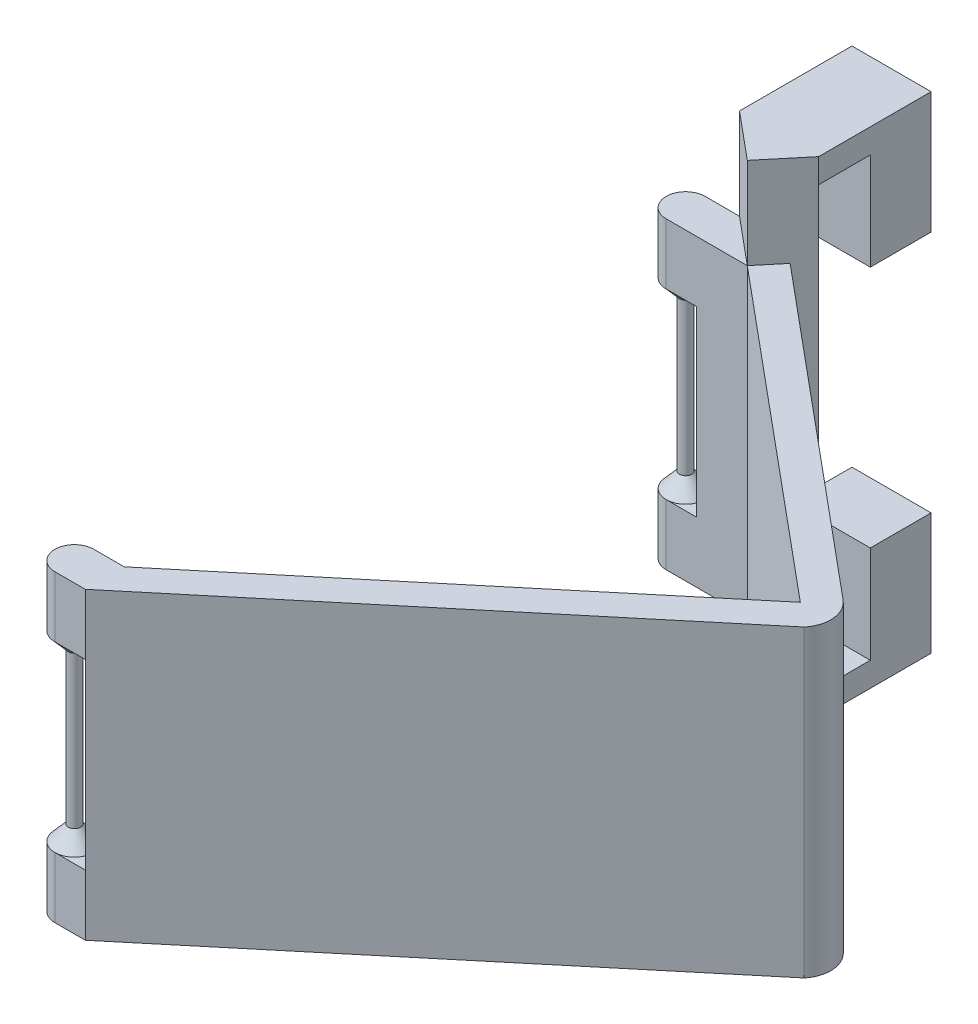
from build123d import *

# Parameters (mm, degrees)
EXTRUDE_1_DEPTH  = 50
EXTRUDE_START    = -50
EXTRUDE_3_DEPTH  = 65
SKETCH_5_W       = 13.017082793
SKETCH_5_H       = 4
EXTRUDE_4_DEPTH  = 18.5
SKETCH_6_W       = 13.017082793
SKETCH_6_H       = 10
EXTRUDE_5_DEPTH  = 16
EXTRUDE_6_DEPTH  = 50
EXTRUDE_7_DEPTH  = 10
EXTRUDE_8_DEPTH  = 10
SKETCH_11_R      = 1
EXTRUDE_9_DEPTH  = 30
SKETCH_15_R      = 1
EXTRUDE_10_DEPTH = 30


with BuildPart() as part:
    # 草图1 → 凸台-拉伸1 (new body)
    with BuildSketch(Plane(origin=(0, 0, 0), x_dir=(1, 0, 0), z_dir=(0, 1, 0))):
        with BuildLine():
            Line((7.810249676, 50), (0, 50))
            Line((0, 50), (60, 0))
            Line((60, 0), (-0.663965605, -50.553304671))
            Line((-0.663965605, -50.553304671), (-0.663965605, -56.955148667))
            Line((-0.663965605, -56.955148667), (63.841106398, -3.200921998))
            ThreePointArc((63.841106398, -3.200921998), (64.979466032, 0.45267873), (63.200921998, 3.841106398))
            Line((63.200921998, 3.841106398), (7.810249676, 50))
        make_face()
    extrude(amount=EXTRUDE_1_DEPTH)

    # 草图4 → 凸台-拉伸3 (add)
    with BuildSketch(Plane(origin=(0, 50, 0), x_dir=(1, 0, 0), z_dir=(0, 1, 0)).offset(EXTRUDE_START)):
        Polygon((0, 50), (7.682212796, 43.598156003), (13.017082793, 50), align=None)
    extrude_3 = extrude(amount=EXTRUDE_3_DEPTH)

    # 草图5 → 凸台-拉伸4 (add)
    with BuildSketch(Plane(origin=(0, 0, -50), x_dir=(-1, 0, 0), z_dir=(0, 0, -1))):
        with Locations((-6.508541397, 63)):
            Rectangle(SKETCH_5_W, SKETCH_5_H)
    extrude_4 = extrude(amount=EXTRUDE_4_DEPTH)

    # 草图6 → 凸台-拉伸5 (add)
    with BuildSketch(Plane.XZ.offset(-61)):
        with Locations((6.508541397, -63.5)):
            Rectangle(SKETCH_6_W, SKETCH_6_H)
    extrude_5 = extrude(amount=EXTRUDE_5_DEPTH)

    # 镜向4: 凸台-拉伸3, 凸台-拉伸4, 凸台-拉伸5 across plane
    add(extrude_3.mirror(Plane(origin=(0, 25, 0), x_dir=(0, 0, 1), z_dir=(0, -1, 0))))
    add(extrude_4.mirror(Plane(origin=(0, 25, 0), x_dir=(0, 0, 1), z_dir=(0, -1, 0))))
    add(extrude_5.mirror(Plane(origin=(0, 25, 0), x_dir=(0, 0, 1), z_dir=(0, -1, 0))))

    # 草图8 → 凸台-拉伸6 (add)
    with BuildSketch(Plane(origin=(0, 50, 0), x_dir=(1, 0, 0), z_dir=(0, 1, 0))):
        Polygon((7.682212796, 43.598156003), (-0.663965605, 43.598156003), (-0.663965605, 50), (0, 50), align=None)
    extrude(amount=-EXTRUDE_6_DEPTH)

    # 草图9 → 凸台-拉伸7 (add)
    with BuildSketch(Plane.XZ):
        with BuildLine():
            Line((-0.663965605, 50.553304671), (-0.663965605, 56.955148667))
            Line((-0.663965605, 56.955148667), (-5.663965605, 56.955148667))
            ThreePointArc((-5.663965605, 56.955148667), (-8.864887603, 53.754226669), (-5.663965605, 50.553304671))
            Line((-5.663965605, 50.553304671), (-0.663965605, 50.553304671))
        make_face()
    extrude_7 = extrude(amount=-EXTRUDE_7_DEPTH)

    # 草图10 → 凸台-拉伸8 (add)
    with BuildSketch(Plane.XZ):
        with BuildLine():
            Line((-0.663965605, -50), (-0.663965605, -43.598156003))
            Line((-0.663965605, -43.598156003), (-5.663965605, -43.598156003))
            ThreePointArc((-5.663965605, -43.598156003), (-8.864887603, -46.799078002), (-5.663965605, -50))
            Line((-5.663965605, -50), (-0.663965605, -50))
        make_face()
    extrude_8 = extrude(amount=-EXTRUDE_8_DEPTH)

    # 镜向5: 凸台-拉伸7, 凸台-拉伸8 across plane
    add(extrude_7.mirror(Plane(origin=(0, 25, 0), x_dir=(0, 0, 1), z_dir=(0, -1, 0))))
    add(extrude_8.mirror(Plane(origin=(0, 25, 0), x_dir=(0, 0, 1), z_dir=(0, -1, 0))))

    # 草图11 → 凸台-拉伸9 (add)
    with BuildSketch(Plane.XZ.offset(-40)):
        with Locations((-5.663965605, 53.754226669)):
            Circle(SKETCH_11_R)
    extrude(amount=EXTRUDE_9_DEPTH)

    # 草图14 → 旋转1 (revolve)
    with BuildSketch(Plane(origin=(0, 0, 53.754226669), x_dir=(-1, 0, 0), z_dir=(0, 0, -1))):
        Polygon((6.663965605, 12.5), (6.663965605, 10), (8.864887603, 10), align=None)
    revolve_1 = revolve(axis=Axis((-5.663965605, 10, 53.754226669), (0, 1, 0)))

    # 镜向6: 旋转1 across plane
    add(revolve_1.mirror(Plane(origin=(0, 25, 0), x_dir=(0, 0, 1), z_dir=(0, -1, 0))))

    # 草图15 → 凸台-拉伸10 (add)
    with BuildSketch(Plane(origin=(0, 10, 0), x_dir=(1, 0, 0), z_dir=(0, 1, 0))):
        with Locations((-5.663965605, 46.799078002)):
            Circle(SKETCH_15_R)
    extrude(amount=EXTRUDE_10_DEPTH)

    # 草图17 → 旋转2 (revolve)
    with BuildSketch(Plane.XY.offset(-46.799078002)):
        Polygon((-6.663965605, 10), (-6.663965605, 12.5), (-8.864887603, 10), align=None)
    revolve_2 = revolve(axis=Axis((-5.663965605, 40, -46.799078002), (0, -1, 0)))

    # 镜向7: 旋转2 across plane
    add(revolve_2.mirror(Plane(origin=(0, 25, 0), x_dir=(0, 0, 1), z_dir=(0, -1, 0))))


solid = part.part
